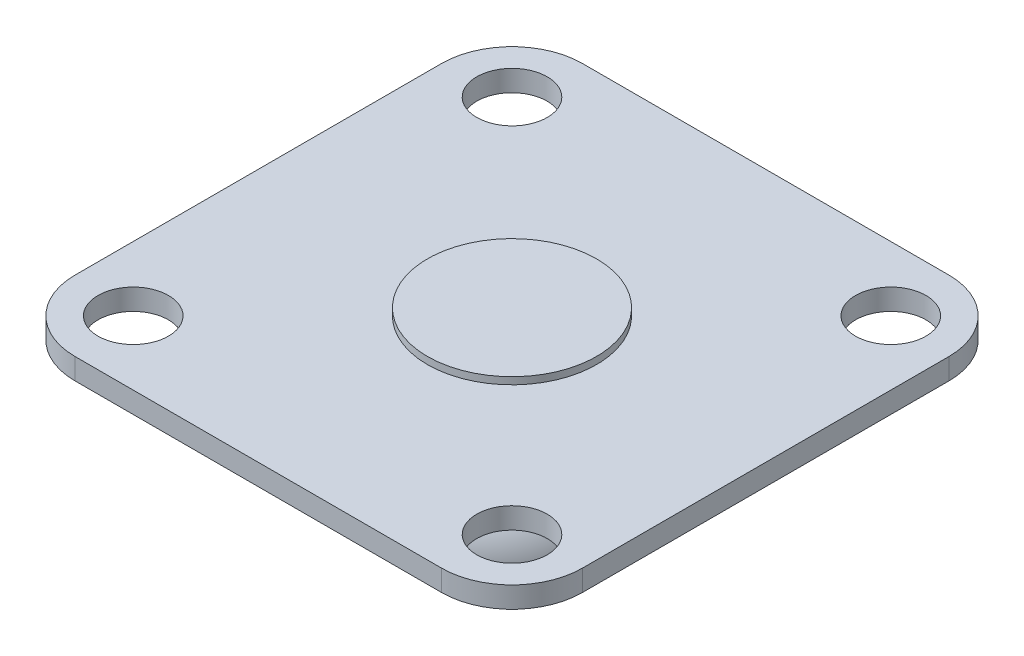
from build123d import *

# Parameters (mm, degrees)
SKETCH1_R                = 2.5
BOSS_EXTRUDE1_DEPTH      = 1.5
BOSS_EXTRUDE2_DEPTH      = 4
BOSS_EXTRUDE2_DEPTH_BACK = 2
SKETCH2_R                = 6
SKETCH3_R                = 9
SKETCH3_R_2              = 6
BOSS_EXTRUDE3_DEPTH      = 5
FILLET1_R                = 5


with BuildPart() as part:
    # Sketch1 → Boss-Extrude1 (new body)
    with BuildSketch(Plane(origin=(0, 0, 0), x_dir=(1, 0, 0), z_dir=(0, 1, 0))):
        with BuildLine():
            Line((-13, -18), (13, -18))
            ThreePointArc((13, -18), (16.535533906, -16.535533906), (18, -13))
            Line((18, -13), (18, 13))
            ThreePointArc((18, 13), (16.535533906, 16.535533906), (13, 18))
            Line((13, 18), (-13, 18))
            ThreePointArc((-13, 18), (-16.535533906, 16.535533906), (-18, 13))
            Line((-18, 13), (-18, -13))
            ThreePointArc((-18, -13), (-16.535533906, -16.535533906), (-13, -18))
        make_face()
        with Locations(Location((13.435028843, 13.435028843, 0), (0, 0, 270))):
            Circle(SKETCH1_R, mode=Mode.SUBTRACT)
        with Locations(Location((-13.435028843, -13.435028843, 0), (0, 0, 270))):
            Circle(SKETCH1_R, mode=Mode.SUBTRACT)
        with Locations(Location((-13.435028843, 13.435028843, 0), (0, 0, 270))):
            Circle(SKETCH1_R, mode=Mode.SUBTRACT)
        with Locations(Location((13.435028843, -13.435028843, 0), (0, 0, 270))):
            Circle(SKETCH1_R, mode=Mode.SUBTRACT)
    extrude(amount=BOSS_EXTRUDE1_DEPTH)

    # Sketch2 → Boss-Extrude2 (add, two sides: drawn at the far end of the back side and taken through both)
    with BuildSketch(Plane.XZ.offset(-BOSS_EXTRUDE2_DEPTH_BACK)):
        with Locations(Location((0, 0, 0), (0, 0, 270))):
            Circle(SKETCH2_R)
    extrude(amount=BOSS_EXTRUDE2_DEPTH + BOSS_EXTRUDE2_DEPTH_BACK)

    # Sketch3 → Boss-Extrude3 (add)
    with BuildSketch(Plane(origin=(0, -3, 0), x_dir=(-1, 0, 0), z_dir=(0, -1, 0))):
        with Locations(Location((0, 0, 0), (0, 0, 90))):
            Circle(SKETCH3_R)
        with Locations(Location((0, 0, 0), (0, 0, 90))):
            Circle(SKETCH3_R_2, mode=Mode.SUBTRACT)
    extrude(amount=BOSS_EXTRUDE3_DEPTH)

    # Fillet1
    # the kernel refuses this fillet: 5 mm, written as the material it takes off along each edge
    with BuildSketch(Plane(origin=(0, -3, 0), x_dir=(0, 0, -1), z_dir=(-1, 0, 0))) as fillet1_piece_1:
        with BuildLine():
            CenterArc((4, 4.582575695), FILLET1_R, 293.578178478, 66.421821522)
            Line((9, 4.582575695), (9.1, 4.582575695))
            Line((9.1, 4.582575695), (9.1, 0))
            Line((9.1, 0), (9, -0.1))
            ThreePointArc((9, -0.1), (7.5, -0.1), (6.04, -0.091651514))
            Line((6.04, -0.091651514), (6, 0))
        make_face()
    revolve(axis=Axis((0, -3, 0), (0, -1, 0)), mode=Mode.SUBTRACT)


solid = part.part
